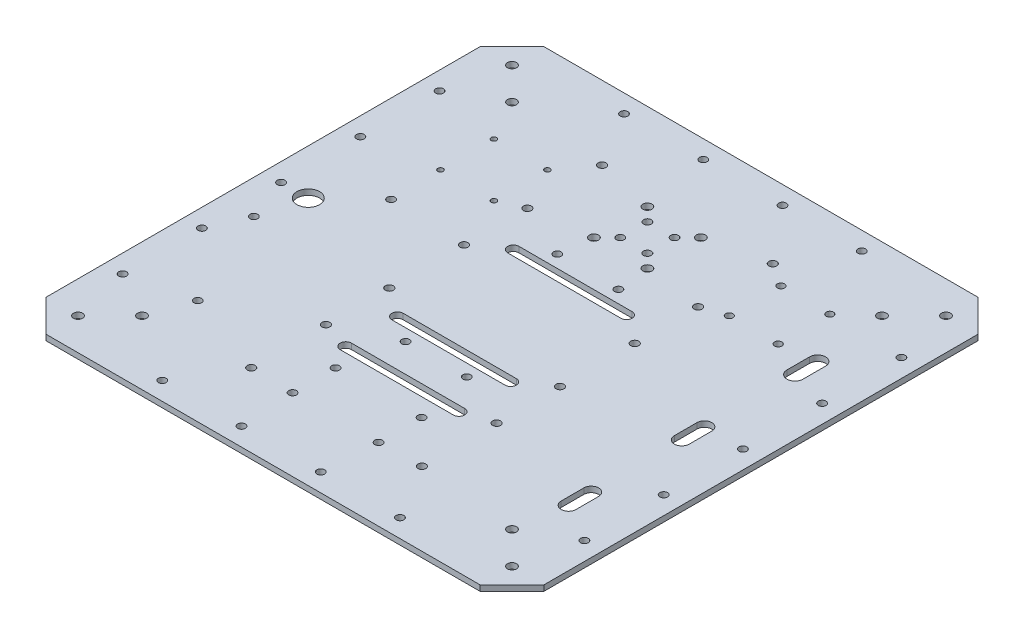
from build123d import *

# Parameters (mm, degrees)
BOSS_EXTRUDE1_DEPTH = 3.175
SKETCH2_R           = 2.159
CUT_EXTRUDE1_DEPTH  = 257.37661277
CUT_EXTRUDE2_DEPTH  = 257.37661277
SKETCH7_R           = 1.524
CUT_EXTRUDE3_DEPTH  = 257.37661277
SKETCH10_R          = 2.159
CUT_EXTRUDE6_DEPTH  = 257.37661277
SKETCH9_R           = 2.032
CUT_EXTRUDE5_DEPTH  = 257.37661277
SKETCH13_R          = 2.54
SKETCH13_R_2        = 2.159
CUT_EXTRUDE8_DEPTH  = 257.37661277
SKETCH14_R          = 2.54
CUT_EXTRUDE9_DEPTH  = 257.37661277
SKETCH15_R          = 2.159
CUT_EXTRUDE10_DEPTH = 257.37661277
SKETCH16_R          = 2.159
CUT_EXTRUDE11_DEPTH = 257.37661277
SKETCH17_R          = 2.2225
CUT_EXTRUDE13_DEPTH = 257.37661277
CUT_EXTRUDE14_DEPTH = 257.37661277
SKETCH20_R          = 6.35
CUT_EXTRUDE15_DEPTH = 257.37661277


with BuildPart() as part:
    # Sketch1 → Boss-Extrude1 (new body)
    with BuildSketch(Plane(origin=(0, 0, 0), x_dir=(1, 0, 0), z_dir=(0, 1, 0))):
        Polygon((-142.524216069, 79.491173458), (-160.484728311, 61.530661216), (-160.484728311, -181.9483143), (-142.524216069, -199.908826542), (100.954759447, -199.908826542), (118.915271689, -181.9483143), (118.915271689, 61.530661216), (100.954759447, 79.491173458), align=None)
    extrude(amount=BOSS_EXTRUDE1_DEPTH)

    # Sketch2 → Cut-Extrude1 (cut, through all)
    with BuildSketch(Plane(origin=(0, 3.175, 0), x_dir=(1, 0, 0), z_dir=(0, 1, 0))):
        with Locations((-38.056728311, -17.536826542)):
            Circle(SKETCH2_R)
        with Locations((-3.766728311, -17.536826542)):
            Circle(SKETCH2_R)
        with Locations((-38.056728311, -102.626826542)):
            Circle(SKETCH2_R)
        with Locations((-3.766728311, -102.626826542)):
            Circle(SKETCH2_R)
    extrude(amount=-CUT_EXTRUDE1_DEPTH, mode=Mode.SUBTRACT)

    # Sketch4 → Cut-Extrude2 (cut, through all)
    with BuildSketch(Plane(origin=(0, 3.175, 0), x_dir=(1, 0, 0), z_dir=(0, 1, 0))):
        with BuildLine():
            Line((-52.534728311, -24.533826542), (10.965271689, -24.533826542))
            ThreePointArc((10.965271689, -24.533826542), (14.140271689, -27.708826542), (10.965271689, -30.883826542))
            Line((10.965271689, -30.883826542), (-52.534728311, -30.883826542))
            ThreePointArc((-52.534728311, -30.883826542), (-55.709728311, -27.708826542), (-52.534728311, -24.533826542))
        make_face()
        with BuildLine():
            Line((-52.534728311, -89.533826542), (10.965271689, -89.533826542))
            ThreePointArc((10.965271689, -89.533826542), (14.140271689, -92.708826542), (10.965271689, -95.883826542))
            Line((10.965271689, -95.883826542), (-52.534728311, -95.883826542))
            ThreePointArc((-52.534728311, -95.883826542), (-55.709728311, -92.708826542), (-52.534728311, -89.533826542))
        make_face()
        with BuildLine():
            Line((-52.534728311, -118.533006542), (10.965271689, -118.533006542))
            ThreePointArc((10.965271689, -118.533006542), (14.140271689, -121.708006542), (10.965271689, -124.883006542))
            Line((10.965271689, -124.883006542), (-52.534728311, -124.883006542))
            ThreePointArc((-52.534728311, -124.883006542), (-55.709728311, -121.708006542), (-52.534728311, -118.533006542))
        make_face()
    extrude(amount=-CUT_EXTRUDE2_DEPTH, mode=Mode.SUBTRACT)

    # Sketch7 → Cut-Extrude3 (cut, through all)
    with BuildSketch(Plane(origin=(0, 3.175, 0), x_dir=(1, 0, 0), z_dir=(0, 1, 0))):
        with Locations((-81.744728311, 20.563173458)):
            Circle(SKETCH7_R)
        with Locations((-81.744728311, -9.408826542)):
            Circle(SKETCH7_R)
        with Locations((-111.716728311, -9.408826542)):
            Circle(SKETCH7_R)
        with Locations((-111.716728311, 20.563173458)):
            Circle(SKETCH7_R)
    extrude(amount=-CUT_EXTRUDE3_DEPTH, mode=Mode.SUBTRACT)

    # Sketch10 → Cut-Extrude6 (cut, through all)
    with BuildSketch(Plane.XZ):
        with Locations((-44.914728311, 159.173006542)):
            Circle(SKETCH10_R)
        with Locations((3.345271689, 159.173006542)):
            Circle(SKETCH10_R)
        with Locations((-44.914728311, 135.043006542)):
            Circle(SKETCH10_R)
        with Locations((3.345271689, 135.043006542)):
            Circle(SKETCH10_R)
    extrude(amount=-CUT_EXTRUDE6_DEPTH, mode=Mode.SUBTRACT)

    # Sketch9 → Cut-Extrude5 (cut, through all)
    with BuildSketch(Plane(origin=(0, 0, 0), x_dir=(-1, 0, 0), z_dir=(0, -1, 0))):
        with Locations((-40.175271689, 0.751173458)):
            Circle(SKETCH9_R)
        with Locations((-67.607271689, 0.751173458)):
            Circle(SKETCH9_R)
        with Locations((-40.175271689, 29.707173458)):
            Circle(SKETCH9_R)
        with Locations((-67.607271689, 29.707173458)):
            Circle(SKETCH9_R)
    extrude(amount=-CUT_EXTRUDE5_DEPTH, mode=Mode.SUBTRACT)

    # Sketch13 → Cut-Extrude8 (cut, through all)
    with BuildSketch(Plane.XZ):
        with Locations((-35.784728311, -0.751173458)):
            Circle(SKETCH13_R)
        with Locations((-35.784728311, -30.751173458)):
            Circle(SKETCH13_R)
        with Locations((-5.784728311, -30.751173458)):
            Circle(SKETCH13_R)
        with Locations((-5.784728311, -0.751173458)):
            Circle(SKETCH13_R)
        with Locations((-28.404728311, -23.371173458)):
            Circle(SKETCH13_R_2)
        with Locations((-28.404728311, -8.131173458)):
            Circle(SKETCH13_R_2)
        with Locations((-13.164728311, -8.131173458)):
            Circle(SKETCH13_R_2)
        with Locations((-13.164728311, -23.371173458)):
            Circle(SKETCH13_R_2)
    extrude(amount=-CUT_EXTRUDE8_DEPTH, mode=Mode.SUBTRACT)

    # Sketch14 → Cut-Extrude9 (cut, through all)
    with BuildSketch(Plane.XZ):
        with Locations((-142.524216069, 181.9483143)):
            Circle(SKETCH14_R)
        with Locations((-124.563703827, 163.987802058)):
            Circle(SKETCH14_R)
        with Locations((82.994247204, 163.987802058)):
            Circle(SKETCH14_R)
        with Locations((100.954759447, 181.9483143)):
            Circle(SKETCH14_R)
        with Locations((-142.524216069, -61.530661216)):
            Circle(SKETCH14_R)
        with Locations((-124.563703827, -43.570148974)):
            Circle(SKETCH14_R)
        with Locations((100.954759447, -61.530661216)):
            Circle(SKETCH14_R)
        with Locations((82.994247204, -43.570148974)):
            Circle(SKETCH14_R)
    extrude(amount=-CUT_EXTRUDE9_DEPTH, mode=Mode.SUBTRACT)

    # Sketch15 → Cut-Extrude10 (cut, through all)
    with BuildSketch(Plane.XZ):
        with Locations((-43.009728311, 189.748826542)):
            Circle(SKETCH15_R)
        with Locations((-87.459728311, 189.748826542)):
            Circle(SKETCH15_R)
        with Locations((-150.324728311, 60.208826542)):
            Circle(SKETCH15_R)
        with Locations((-150.324728311, 104.658826542)):
            Circle(SKETCH15_R)
        with Locations((-150.324728311, 149.108826542)):
            Circle(SKETCH15_R)
        with Locations((108.755271689, 149.108826542)):
            Circle(SKETCH15_R)
        with Locations((108.755271689, 104.658826542)):
            Circle(SKETCH15_R)
        with Locations((108.755271689, 60.208826542)):
            Circle(SKETCH15_R)
        with Locations((45.890271689, 189.748826542)):
            Circle(SKETCH15_R)
        with Locations((1.440271689, 189.748826542)):
            Circle(SKETCH15_R)
        with Locations((1.440271689, -69.331173458)):
            Circle(SKETCH15_R)
        with Locations((45.890271689, -69.331173458)):
            Circle(SKETCH15_R)
        with Locations((108.755271689, 15.758826542)):
            Circle(SKETCH15_R)
        with Locations((108.755271689, -28.691173458)):
            Circle(SKETCH15_R)
        with Locations((-150.324728311, -28.691173458)):
            Circle(SKETCH15_R)
        with Locations((-150.324728311, 15.758826542)):
            Circle(SKETCH15_R)
        with Locations((-87.459728311, -69.331173458)):
            Circle(SKETCH15_R)
        with Locations((-43.009728311, -69.331173458)):
            Circle(SKETCH15_R)
    extrude(amount=-CUT_EXTRUDE10_DEPTH, mode=Mode.SUBTRACT)

    # Sketch16 → Cut-Extrude11 (cut, through all)
    with BuildSketch(Plane(origin=(0, 0, 0), x_dir=(-1, 0, 0), z_dir=(0, -1, 0))):
        with Locations((141.434728311, -84.424826542)):
            Circle(SKETCH16_R)
        with Locations((111.208728311, -37.602826542)):
            Circle(SKETCH16_R)
        with Locations((116.288728311, -140.980826542)):
            Circle(SKETCH16_R)
    extrude(amount=-CUT_EXTRUDE11_DEPTH, mode=Mode.SUBTRACT)

    # Sketch17 → Cut-Extrude13 (cut, through all)
    with BuildSketch(Plane(origin=(0, 3.175, 0), x_dir=(1, 0, 0), z_dir=(0, 1, 0))):
        with Locations((27.094271689, -158.633826542)):
            Circle(SKETCH17_R)
        with Locations((-68.663728311, -158.633826542)):
            Circle(SKETCH17_R)
        with Locations((27.094271689, -116.723826542)):
            Circle(SKETCH17_R)
        with Locations((-68.663728311, -116.723826542)):
            Circle(SKETCH17_R)
        with Locations((27.094271689, -81.163826542)):
            Circle(SKETCH17_R)
        with Locations((-68.663728311, -81.163826542)):
            Circle(SKETCH17_R)
        with Locations((27.094271689, -39.253826542)):
            Circle(SKETCH17_R)
        with Locations((-68.663728311, -39.253826542)):
            Circle(SKETCH17_R)
        with Locations((27.094271689, -3.693826542)):
            Circle(SKETCH17_R)
        with Locations((-68.663728311, -3.693826542)):
            Circle(SKETCH17_R)
        with Locations((27.094271689, 38.216173458)):
            Circle(SKETCH17_R)
        with Locations((-68.663728311, 38.216173458)):
            Circle(SKETCH17_R)
    extrude(amount=-CUT_EXTRUDE13_DEPTH, mode=Mode.SUBTRACT)

    # Sketch19 → Cut-Extrude14 (cut, through all)
    with BuildSketch(Plane(origin=(0, 3.175, 0), x_dir=(1, 0, 0), z_dir=(0, 1, 0))):
        with BuildLine():
            Line((83.016850731, -136.408826542), (83.016850731, -123.708826542))
            ThreePointArc((83.016850731, -123.708826542), (87.165271689, -119.560405585), (91.313692646, -123.708826542))
            Line((91.313692646, -123.708826542), (91.313692646, -136.408826542))
            ThreePointArc((91.313692646, -136.408826542), (87.165271689, -140.5572475), (83.016850731, -136.408826542))
        make_face()
        with BuildLine():
            Line((83.016850731, -72.908826542), (83.016850731, -60.208826542))
            ThreePointArc((83.016850731, -60.208826542), (87.165271689, -56.060405585), (91.313692646, -60.208826542))
            Line((91.313692646, -60.208826542), (91.313692646, -72.908826542))
            ThreePointArc((91.313692646, -72.908826542), (87.165271689, -77.0572475), (83.016850731, -72.908826542))
        make_face()
        with BuildLine():
            Line((82.671148985, -9.408826542), (82.671148985, 3.291173458))
            ThreePointArc((82.671148985, 3.291173458), (87.165271689, 7.785296162), (91.659394393, 3.291173458))
            Line((91.659394393, 3.291173458), (91.659394393, -9.408826542))
            ThreePointArc((91.659394393, -9.408826542), (87.165271689, -13.902949246), (82.671148985, -9.408826542))
        make_face()
    extrude(amount=-CUT_EXTRUDE14_DEPTH, mode=Mode.SUBTRACT)

    # Sketch20 → Cut-Extrude15 (cut, through all)
    with BuildSketch(Plane(origin=(0, 3.175, 0), x_dir=(1, 0, 0), z_dir=(0, 1, 0))):
        with Locations((-135.084728311, -60.208826542)):
            Circle(SKETCH20_R)
    extrude(amount=-CUT_EXTRUDE15_DEPTH, mode=Mode.SUBTRACT)


solid = part.part
